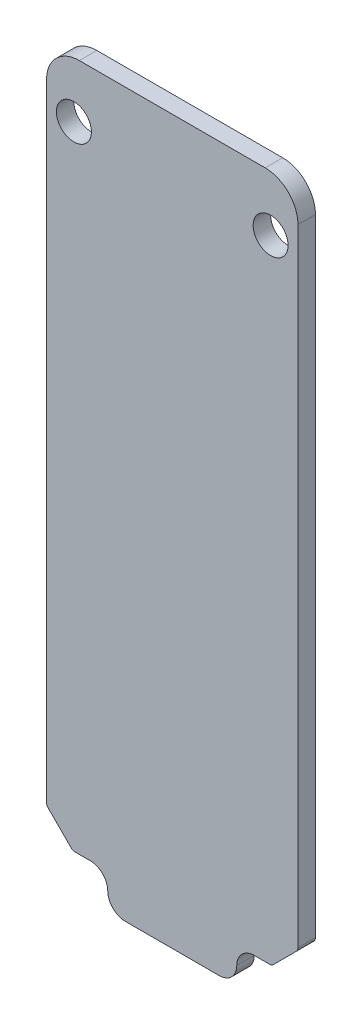
from build123d import *

# Parameters (mm, degrees)
BOSS_EXTRUDE1_DEPTH  = 1.6
FILLET1_R            = 3
FILLET2_START        = -1
FILLET2_DEPTH        = 4
FILLET2_2_DEPTH      = 1.6
FILLET3_R            = 0.5
M3_CLEARANCE_HOLE1_D = 3.2


with BuildPart() as part:
    # Sketch1 → Boss-Extrude1 (new body)
    with BuildSketch(Plane.XY):
        Polygon((11.5, 83.1), (-11.5, 83.1), (-11.5, 22.6), (-9.1, 20.2), (-5.9, 20.2), (-5.9, 17), (5.9, 17), (5.9, 20.2), (9.1, 20.2), (11.5, 22.6), align=None)
    extrude(amount=BOSS_EXTRUDE1_DEPTH)

    # Fillet1
    fillet1_edges = [part.edges().sort_by_distance(p)[0] for p in [
        (-11.5, 83.1, 0.8),
        (11.5, 83.1, 0.8),
    ]]
    fillet(fillet1_edges, radius=FILLET1_R)

    # Fillet2: read off the stored shape, not the designer's step
    # Fillet2 outline → Fillet2 (cut)
    with BuildSketch(Plane.XY.offset(FILLET2_START)):
        with BuildLine():
            ThreePointArc((5.9, 18.6), (5.43137085, 17.46862915), (4.3, 17))
            Line((4.3, 17), (5.9, 17))
            Line((5.9, 17), (5.9, 18.6))
        make_face()
        with BuildLine():
            ThreePointArc((-4.3, 17), (-5.43137085, 17.46862915), (-5.9, 18.6))
            Line((-5.9, 18.6), (-5.9, 17))
            Line((-5.9, 17), (-4.3, 17))
        make_face()
    extrude(amount=FILLET2_DEPTH, mode=Mode.SUBTRACT)

    # Fillet2 2 outline → Fillet2 2 (add)
    with BuildSketch(Plane.XY):
        with BuildLine():
            Line((5.9, 20.2), (5.9, 18.6))
            ThreePointArc((5.9, 18.6), (6.36862915, 19.73137085), (7.5, 20.2))
            Line((7.5, 20.2), (5.9, 20.2))
        make_face()
        with BuildLine():
            ThreePointArc((-7.5, 20.2), (-6.36862915, 19.73137085), (-5.9, 18.6))
            Line((-5.9, 18.6), (-5.9, 20.2))
            Line((-5.9, 20.2), (-7.5, 20.2))
        make_face()
    extrude(amount=FILLET2_2_DEPTH)

    # Fillet3
    fillet3_edges = [part.edges().sort_by_distance(p)[0] for p in [
        (-11.5, 22.6, 0.8),
        (11.5, 22.6, 0.8),
        (9.1, 20.2, 0.8),
        (-9.1, 20.2, 0.8),
    ]]
    fillet(fillet3_edges, radius=FILLET3_R)

    # M3 Clearance Hole1 (through all)
    with Locations(Plane.XY.offset(1.6)):
        with Locations((-9, 78), (9, 78)):
            Hole(M3_CLEARANCE_HOLE1_D / 2)


solid = part.part
